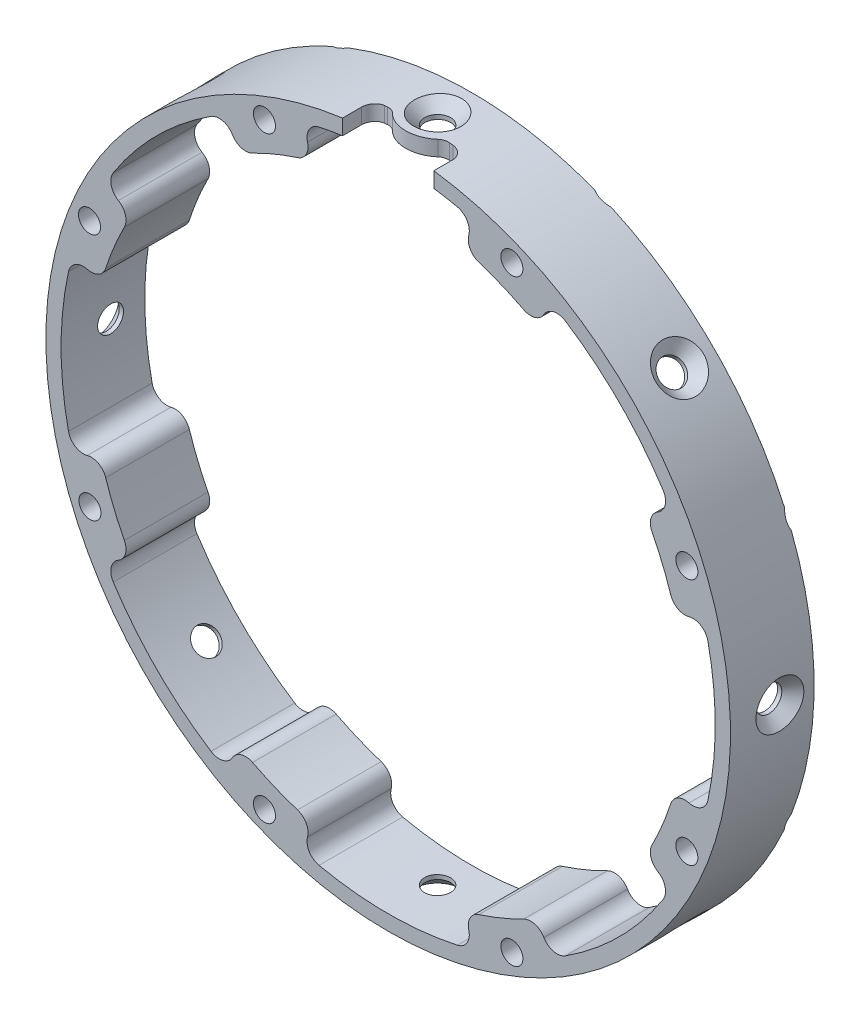
from build123d import *

# Parameters (mm, degrees)
SKETCH_1_R                             = 45
EXTRUDE_1_DEPTH                        = 11
HOLE_WIZARD_M3_2_D                     = 3.4
HOLE_WIZARD_M3_2_CSINK_D               = 6.3
HOLE_WIZARD_M3_2_CSINK_ANGLE           = 90
HOLE_WIZARD_M3_2_ON_FACE_2_D           = 3.4
HOLE_WIZARD_M3_2_ON_FACE_2_CSINK_D     = 6.3
HOLE_WIZARD_M3_2_ON_FACE_2_CSINK_ANGLE = 90
HOLE_WIZARD_M3_2_ON_FACE_3_D           = 3.4
HOLE_WIZARD_M3_2_ON_FACE_3_CSINK_D     = 6.3
HOLE_WIZARD_M3_2_ON_FACE_3_CSINK_ANGLE = 90
HOLE_WIZARD_M3_2_ON_FACE_4_D           = 3.4
HOLE_WIZARD_M3_2_ON_FACE_4_CSINK_D     = 6.3
HOLE_WIZARD_M3_2_ON_FACE_4_CSINK_ANGLE = 90
HOLE_WIZARD_M3_2_ON_FACE_5_D           = 3.4
HOLE_WIZARD_M3_2_ON_FACE_5_CSINK_D     = 6.3
HOLE_WIZARD_M3_2_ON_FACE_5_CSINK_ANGLE = 90
HOLE_WIZARD_M3_2_ON_FACE_6_D           = 3.4
HOLE_WIZARD_M3_2_ON_FACE_6_CSINK_D     = 6.3
HOLE_WIZARD_M3_2_ON_FACE_6_CSINK_ANGLE = 90
HOLE_WIZARD_M3_2_ON_FACE_7_D           = 3.4
HOLE_WIZARD_M3_2_ON_FACE_7_CSINK_D     = 6.3
HOLE_WIZARD_M3_2_ON_FACE_7_CSINK_ANGLE = 90
HOLE_WIZARD_M3_2_ON_FACE_8_D           = 3.4
HOLE_WIZARD_M3_2_ON_FACE_8_CSINK_D     = 6.3
HOLE_WIZARD_M3_2_ON_FACE_8_CSINK_ANGLE = 90
CUT_EXTRUDE_1_REACH                    = 103.223
CUT_EXTRUDE_1_END_RADIUS               = 43
HOLE_WIZARD_M2_5_2_D                   = 2.9
HOLE_WIZARD_M2_5_2_CSINK_D             = 5.5
HOLE_WIZARD_M2_5_2_CSINK_ANGLE         = 90
FILLET_1_R                             = 2
FILLET_2_R                             = 1.5


# Some blends are built 0.0001 mm under size
with BuildPart() as part:
    # 草图1 → 凸台-拉伸1 (new body)
    with BuildSketch(Plane.XY):
        Circle(SKETCH_1_R)
        with BuildLine():
            Line((11.129218939, 41.53481053), (10.093942759, 37.671107225))
            ThreePointArc((10.093942759, 37.671107225), (14.924653862, 36.031301768), (19.5, 33.774990748))
            Line((19.5, 33.774990748), (21.5, 37.239092363))
            ThreePointArc((21.5, 37.239092363), (30.405591591, 30.405591591), (37.239092363, 21.5))
            Line((37.239092363, 21.5), (33.774990748, 19.5))
            ThreePointArc((33.774990748, 19.5), (36.031301768, 14.924653862), (37.671107225, 10.093942759))
            Line((37.671107225, 10.093942759), (41.53481053, 11.129218939))
            ThreePointArc((41.53481053, 11.129218939), (43, 0), (41.53481053, -11.129218939))
            Line((41.53481053, -11.129218939), (37.671107225, -10.093942759))
            ThreePointArc((37.671107225, -10.093942759), (36.031301768, -14.924653862), (33.774990748, -19.5))
            Line((33.774990748, -19.5), (37.239092363, -21.5))
            ThreePointArc((37.239092363, -21.5), (30.405591591, -30.405591591), (21.5, -37.239092363))
            Line((21.5, -37.239092363), (19.5, -33.774990748))
            ThreePointArc((19.5, -33.774990748), (14.924653862, -36.031301768), (10.093942759, -37.671107225))
            Line((10.093942759, -37.671107225), (11.129218939, -41.53481053))
            ThreePointArc((11.129218939, -41.53481053), (0, -43), (-11.129218939, -41.53481053))
            Line((-11.129218939, -41.53481053), (-10.093942759, -37.671107225))
            ThreePointArc((-10.093942759, -37.671107225), (-14.924653862, -36.031301768), (-19.5, -33.774990748))
            Line((-19.5, -33.774990748), (-21.5, -37.239092363))
            ThreePointArc((-21.5, -37.239092363), (-30.405591591, -30.405591591), (-37.239092363, -21.5))
            Line((-37.239092363, -21.5), (-33.774990748, -19.5))
            ThreePointArc((-33.774990748, -19.5), (-36.031301768, -14.924653862), (-37.671107225, -10.093942759))
            Line((-37.671107225, -10.093942759), (-41.53481053, -11.129218939))
            ThreePointArc((-41.53481053, -11.129218939), (-43, 0), (-41.53481053, 11.129218939))
            Line((-41.53481053, 11.129218939), (-37.671107225, 10.093942759))
            ThreePointArc((-37.671107225, 10.093942759), (-36.031301768, 14.924653862), (-33.774990748, 19.5))
            Line((-33.774990748, 19.5), (-37.239092363, 21.5))
            ThreePointArc((-37.239092363, 21.5), (-30.405591591, 30.405591591), (-21.5, 37.239092363))
            Line((-21.5, 37.239092363), (-19.5, 33.774990748))
            ThreePointArc((-19.5, 33.774990748), (-14.924653862, 36.031301768), (-10.093942759, 37.671107225))
            Line((-10.093942759, 37.671107225), (-11.129218939, 41.53481053))
            ThreePointArc((-11.129218939, 41.53481053), (0, 43), (11.129218939, 41.53481053))
        make_face(mode=Mode.SUBTRACT)
    extrude(amount=-EXTRUDE_1_DEPTH)

    # M3 锥坑平头的锥孔2 (through all)
    with Locations(Plane(origin=(31.819805153, 31.819805153, -6.5), x_dir=(0.707106781187, -0.707106781187, 0), z_dir=(0.707106781187, 0.707106781187, 0))):
        with Locations((0, 0)):
            CounterSinkHole(HOLE_WIZARD_M3_2_D / 2, HOLE_WIZARD_M3_2_CSINK_D / 2, counter_sink_angle=HOLE_WIZARD_M3_2_CSINK_ANGLE)

    # M3 锥坑平头的锥孔2 on face 2 (through all)
    with Locations(Plane(origin=(45, 0, -6.5), x_dir=(0, 0, 1), z_dir=(1, 0, 0))):
        with Locations((0, 0)):
            CounterSinkHole(HOLE_WIZARD_M3_2_ON_FACE_2_D / 2, HOLE_WIZARD_M3_2_ON_FACE_2_CSINK_D / 2, counter_sink_angle=HOLE_WIZARD_M3_2_ON_FACE_2_CSINK_ANGLE)

    # M3 锥坑平头的锥孔2 on face 3 (through all)
    with Locations(Plane(origin=(31.819805153, -31.819805153, -6.5), x_dir=(-0.707106781187, -0.707106781187, 0), z_dir=(0.707106781187, -0.707106781187, 0))):
        with Locations((0, 0)):
            CounterSinkHole(HOLE_WIZARD_M3_2_ON_FACE_3_D / 2, HOLE_WIZARD_M3_2_ON_FACE_3_CSINK_D / 2, counter_sink_angle=HOLE_WIZARD_M3_2_ON_FACE_3_CSINK_ANGLE)

    # M3 锥坑平头的锥孔2 on face 4 (through all)
    with Locations(Plane(origin=(-31.819805153, 31.819805153, -6.5), x_dir=(0.707106781187, 0.707106781187, 0), z_dir=(-0.707106781187, 0.707106781187, 0))):
        with Locations((0, 0)):
            CounterSinkHole(HOLE_WIZARD_M3_2_ON_FACE_4_D / 2, HOLE_WIZARD_M3_2_ON_FACE_4_CSINK_D / 2, counter_sink_angle=HOLE_WIZARD_M3_2_ON_FACE_4_CSINK_ANGLE)

    # M3 锥坑平头的锥孔2 on face 5 (through all)
    with Locations(Plane(origin=(-31.819805157, -31.81980515, -6.5), x_dir=(-0.707106781187, 0.707106781187, 0), z_dir=(-0.707106781187, -0.707106781187, 0))):
        with Locations((0, 0)):
            CounterSinkHole(HOLE_WIZARD_M3_2_ON_FACE_5_D / 2, HOLE_WIZARD_M3_2_ON_FACE_5_CSINK_D / 2, counter_sink_angle=HOLE_WIZARD_M3_2_ON_FACE_5_CSINK_ANGLE)

    # M3 锥坑平头的锥孔2 on face 6 (through all)
    with Locations(Plane(origin=(0, -45, -6.5), x_dir=(0, 0, -1), z_dir=(0, -1, 0))):
        with Locations((0, 0)):
            CounterSinkHole(HOLE_WIZARD_M3_2_ON_FACE_6_D / 2, HOLE_WIZARD_M3_2_ON_FACE_6_CSINK_D / 2, counter_sink_angle=HOLE_WIZARD_M3_2_ON_FACE_6_CSINK_ANGLE)

    # M3 锥坑平头的锥孔2 on face 7 (through all)
    with Locations(Plane(origin=(0, 45, -6.5), x_dir=(0, 0, 1), z_dir=(0, 1, 0))):
        with Locations((0, 0)):
            CounterSinkHole(HOLE_WIZARD_M3_2_ON_FACE_7_D / 2, HOLE_WIZARD_M3_2_ON_FACE_7_CSINK_D / 2, counter_sink_angle=HOLE_WIZARD_M3_2_ON_FACE_7_CSINK_ANGLE)

    # M3 锥坑平头的锥孔2 on face 8 (through all)
    with Locations(Plane(origin=(-45, 0, -6.5), x_dir=(0, 0, -1), z_dir=(-1, 0, 0))):
        with Locations((0, 0)):
            CounterSinkHole(HOLE_WIZARD_M3_2_ON_FACE_8_D / 2, HOLE_WIZARD_M3_2_ON_FACE_8_CSINK_D / 2, counter_sink_angle=HOLE_WIZARD_M3_2_ON_FACE_8_CSINK_ANGLE)

    # 切除-拉伸1: up to this cylinder (the profile starts outside it)
    cut_extrude_1_end = Plane(origin=(0, 0, -1.737695), z_dir=(0, 0, 1)) * Cylinder(CUT_EXTRUDE_1_END_RADIUS, 293.446, mode=Mode.PRIVATE)
    # 草图7 → 切除-拉伸1 (cut, up to the surface)
    with BuildSketch(Plane(origin=(0, 45, 0), x_dir=(1, 0, 0), z_dir=(0, 1, 0)), mode=Mode.PRIVATE) as cut_extrude_1_sk1:
        with BuildLine():
            Line((-6, 0), (6, 0))
            Line((6, 0), (6, 4))
            Line((6, 4), (3.374907406, 4))
            ThreePointArc((3.374907406, 4), (0, 2.3), (-3.374907406, 4))
            Line((-3.374907406, 4), (-6, 4))
            Line((-6, 4), (-6, 0))
        make_face()
    cut_extrude_1_tool1 = extrude(cut_extrude_1_sk1.sketch, amount=-CUT_EXTRUDE_1_REACH, mode=Mode.PRIVATE) - cut_extrude_1_end
    add(cut_extrude_1_tool1.solids().sort_by_distance((0, 45, -1.737695))[0], mode=Mode.SUBTRACT)

    # M2.5 锥坑平头的锥孔2 (through all)
    with Locations(Plane(origin=(39.26488013, 16.26404588, -11), x_dir=(-1, 0, 0), z_dir=(0, 0, -1))):
        with Locations((0, 0), (23.00083425, 23.00083425), (55.52892601, 23.00083425), (0, -32.52809176), (78.52976026, 0), (78.46926384, -32.52809176), (55.52892601, -55.52892601), (23.00083425, -55.52892601)):
            CounterSinkHole(HOLE_WIZARD_M2_5_2_D / 2, HOLE_WIZARD_M2_5_2_CSINK_D / 2, counter_sink_angle=HOLE_WIZARD_M2_5_2_CSINK_ANGLE)

    # 圆角1
    fillet_1_edges = [part.edges().sort_by_distance(p)[0] for p in [
        (-41.53481053, -11.129218939, -5.5),
        (-37.671107225, -10.093942759, -5.5),
        (-33.774990748, -19.5, -5.5),
        (-37.239092363, -21.5, -5.5),
        (-21.5, -37.239092363, -5.5),
        (-10.093942759, -37.671107225, -5.5),
        (-19.5, -33.774990748, -5.5),
        (-11.129218939, -41.53481053, -5.5),
        (11.129218939, -41.53481053, -5.5),
        (10.093942759, -37.671107225, -5.5),
        (19.5, -33.774990748, -5.5),
        (21.5, -37.239092363, -5.5),
        (37.239092363, -21.5, -5.5),
        (33.774990748, -19.5, -5.5),
        (37.671107225, -10.093942759, -5.5),
        (41.53481053, -11.129218939, -5.5),
        (41.53481053, 11.129218939, -5.5),
        (37.671107225, 10.093942759, -5.5),
        (33.774990748, 19.5, -5.5),
        (37.239092363, 21.5, -5.5),
        (21.5, 37.239092363, -5.5),
        (11.129218939, 41.53481053, -5.5),
        (10.093942759, 37.671107225, -5.5),
        (19.5, 33.774990748, -5.5),
        (-11.129218939, 41.53481053, -5.5),
        (-10.093942759, 37.671107225, -5.5),
        (-21.5, 37.239092363, -5.5),
        (-19.5, 33.774990748, -5.5),
        (-37.239092363, 21.5, -5.5),
        (-33.774990748, 19.5, -5.5),
        (-37.671107225, 10.093942759, -5.5),
        (-41.53481053, 11.129218939, -5.5),
    ]]
    fillet(fillet_1_edges, radius=FILLET_1_R - 0.0001)  # a hair under: the kernel refuses the full size

    # 圆角2
    # the kernel refuses this fillet: 1.5 mm, written as the material it adds along each edge
    with BuildSketch(Plane(origin=(-6, 48.348206242, -4), x_dir=(0, 0, 1), z_dir=(0, -1, 0))) as fillet_2_piece_1_section:
        with BuildLine():
            CenterArc((FILLET_2_R, -FILLET_2_R), FILLET_2_R, 90, 90)
            Line((0, -FILLET_2_R), (0, 0))
            Line((0, 0), (FILLET_2_R, 0))
        make_face()
    fillet_2_piece_1 = extrude(amount=9.51886853, mode=Mode.PRIVATE)
    fillet_2_piece_1 = fillet_2_piece_1 - Plane(origin=(0, 0, -3.660226949), x_dir=(-0.25881904510252085, 0.9659258262890683, 0), z_dir=(0, 0, 1)) * Cylinder(43, 26, mode=Mode.PRIVATE)
    fillet_2_piece_1 = fillet_2_piece_1 & Plane(origin=(0, 0, -3.660226949), x_dir=(1, 0, 0), z_dir=(0, 0, 1)) * Cylinder(45, 26, mode=Mode.PRIVATE)
    add(fillet_2_piece_1)
    with BuildSketch(Plane(origin=(6, 48.348206242, -4), x_dir=(0, 0, 1), z_dir=(0, -1, 0))) as fillet_2_piece_2_section:
        with BuildLine():
            CenterArc((FILLET_2_R, FILLET_2_R), FILLET_2_R, 180, 90)
            Line((0, FILLET_2_R), (0, 0))
            Line((0, 0), (FILLET_2_R, 0))
        make_face()
    fillet_2_piece_2 = extrude(amount=9.51886853, mode=Mode.PRIVATE)
    fillet_2_piece_2 = fillet_2_piece_2 - Plane(origin=(0, 0, -3.660229159), x_dir=(-0.25881904510252085, 0.9659258262890683, 0), z_dir=(0, 0, 1)) * Cylinder(43, 26, mode=Mode.PRIVATE)
    fillet_2_piece_2 = fillet_2_piece_2 & Plane(origin=(0, 0, -3.660229159), x_dir=(1, 0, 0), z_dir=(0, 0, 1)) * Cylinder(45, 26, mode=Mode.PRIVATE)
    add(fillet_2_piece_2)
    with BuildSketch(Plane(origin=(-3.374907406, 46.58796772, -4), x_dir=(-1, 0, 0), z_dir=(0, -1, 0))) as fillet_2_piece_3_section:
        with BuildLine():
            CenterArc((0.685880695, -1.5), FILLET_2_R, 90, 45.432071351)
            ThreePointArc((-0.382747753, -0.447368421), (-0.183525204, -0.230399172), (0, 0))
            Line((0, 0), (0.685880695, 0))
        make_face()
    fillet_2_piece_3 = extrude(amount=5.435315911, mode=Mode.PRIVATE)
    fillet_2_piece_3 = fillet_2_piece_3 - Plane(origin=(0, 0, -3.906202995), x_dir=(-0.25881904510252085, 0.9659258262890683, 0), z_dir=(0, 0, 1)) * Cylinder(43, 14, mode=Mode.PRIVATE)
    fillet_2_piece_3 = fillet_2_piece_3 & Plane(origin=(0, 0, -3.906202995), x_dir=(1, 0, 0), z_dir=(0, 0, 1)) * Cylinder(45, 14, mode=Mode.PRIVATE)
    add(fillet_2_piece_3)
    with BuildSketch(Plane(origin=(3.374907406, 46.58796772, -4), x_dir=(-0.6500950409870627, 0, 0.7598529052941951), z_dir=(0, -1, 0))) as fillet_2_piece_4_section:
        with BuildLine():
            CenterArc((0.69389172, -1.496311), FILLET_2_R, 94.01916071, 45.432071351)
            Line((-0.445887638, -0.521168439), (0, 0))
            ThreePointArc((0, 0), (0.294378305, -0.0103292), (0.588756611, 0))
        make_face()
    fillet_2_piece_4 = extrude(amount=5.435315911, mode=Mode.PRIVATE)
    fillet_2_piece_4 = fillet_2_piece_4 - Plane(origin=(0, 0, -3.906202953), x_dir=(-0.25881904510252085, 0.9659258262890683, 0), z_dir=(0, 0, 1)) * Cylinder(43, 14, mode=Mode.PRIVATE)
    fillet_2_piece_4 = fillet_2_piece_4 & Plane(origin=(0, 0, -3.906202953), x_dir=(1, 0, 0), z_dir=(0, 0, 1)) * Cylinder(45, 14, mode=Mode.PRIVATE)
    add(fillet_2_piece_4)


solid = part.part
